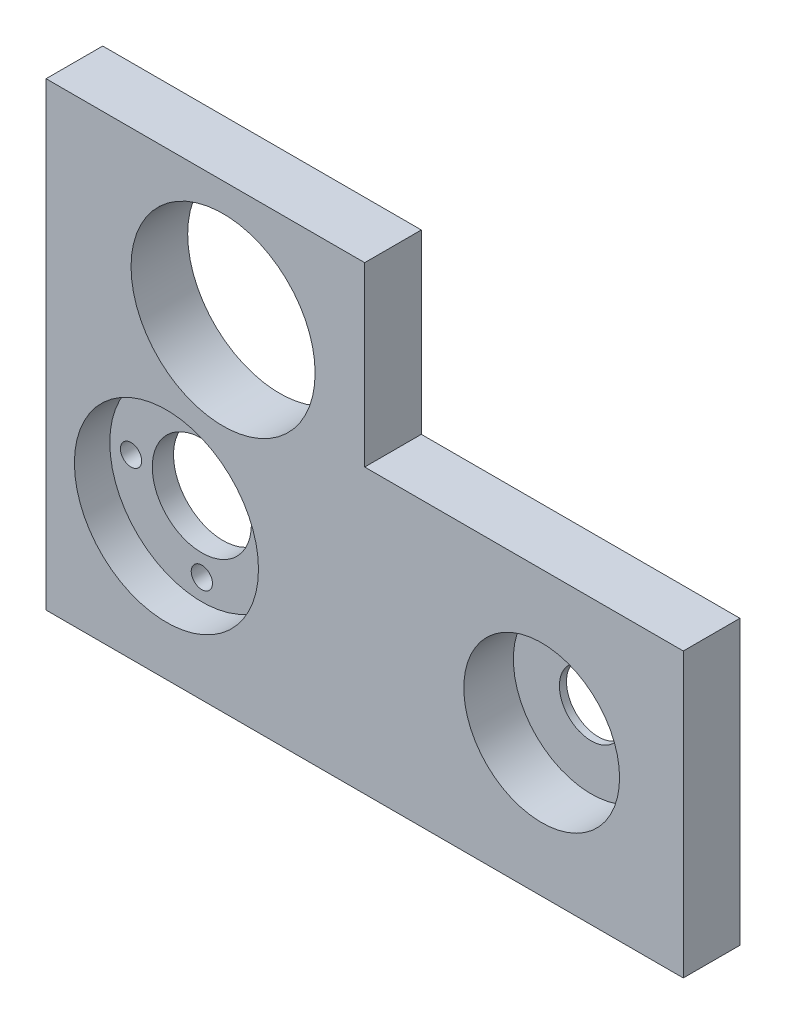
from build123d import *

# Parameters (mm, degrees)
ESQUISSE1_W             = 90
ESQUISSE1_H             = 65
ESQUISSE1_R             = 4.5
ESQUISSE1_R_2           = 13
BOSS_EXTRU_1_DEPTH      = 8
ESQUISSE2_R             = 13
BOSS_EXTRU_2_DEPTH      = 3
ESQUISSE3_R             = 7
ESQUISSE3_R_2           = 1.5
ENL_V_MAT_EXTRU_1_DEPTH = 112.130553854
ESQUISSE4_R             = 11
ENL_V_MAT_EXTRU_2_DEPTH = 7
ESQUISSE5_W             = 45
ESQUISSE5_H             = 25
ENL_V_MAT_EXTRU_3_DEPTH = 112.30588484


with BuildPart() as part:
    # Esquisse1 → Boss.-Extru.1 (new body)
    with BuildSketch(Plane.XY):
        with Locations((45, 32.5)):
            Rectangle(ESQUISSE1_W, ESQUISSE1_H)
        with Locations((70, 20)):
            Circle(ESQUISSE1_R, mode=Mode.SUBTRACT)
        with Locations((17, 20)):
            Circle(ESQUISSE1_R_2, mode=Mode.SUBTRACT)
        with Locations((25, 48)):
            Circle(ESQUISSE1_R_2, mode=Mode.SUBTRACT)
    extrude(amount=BOSS_EXTRU_1_DEPTH)

    # Esquisse2 → Boss.-Extru.2 (add)
    with BuildSketch(Plane(origin=(0, 0, 0), x_dir=(-1, 0, 0), z_dir=(0, 0, -1))):
        with Locations((-17, 20)):
            Circle(ESQUISSE2_R)
    extrude(amount=-BOSS_EXTRU_2_DEPTH)

    # Esquisse3 → Enlèv. mat.-Extru.1 (cut, through all)
    with BuildSketch(Plane.XY.offset(3)):
        with Locations((17, 20)):
            Circle(ESQUISSE3_R)
        with Locations((27, 20)):
            Circle(ESQUISSE3_R_2)
        with Locations((17, 10)):
            Circle(ESQUISSE3_R_2)
        with Locations((7, 20)):
            Circle(ESQUISSE3_R_2)
        with Locations((17, 30)):
            Circle(ESQUISSE3_R_2)
    extrude(amount=-ENL_V_MAT_EXTRU_1_DEPTH, mode=Mode.SUBTRACT)

    # Esquisse4 → Enlèv. mat.-Extru.2 (cut)
    with BuildSketch(Plane.XY.offset(8)):
        with Locations((70, 20)):
            Circle(ESQUISSE4_R)
    extrude(amount=-ENL_V_MAT_EXTRU_2_DEPTH, mode=Mode.SUBTRACT)

    # Esquisse5 → Enlèv. mat.-Extru.3 (cut, through all)
    with BuildSketch(Plane.XY.offset(8)):
        with Locations((67.5, 52.5)):
            Rectangle(ESQUISSE5_W, ESQUISSE5_H)
    extrude(amount=-ENL_V_MAT_EXTRU_3_DEPTH, mode=Mode.SUBTRACT)


solid = part.part
